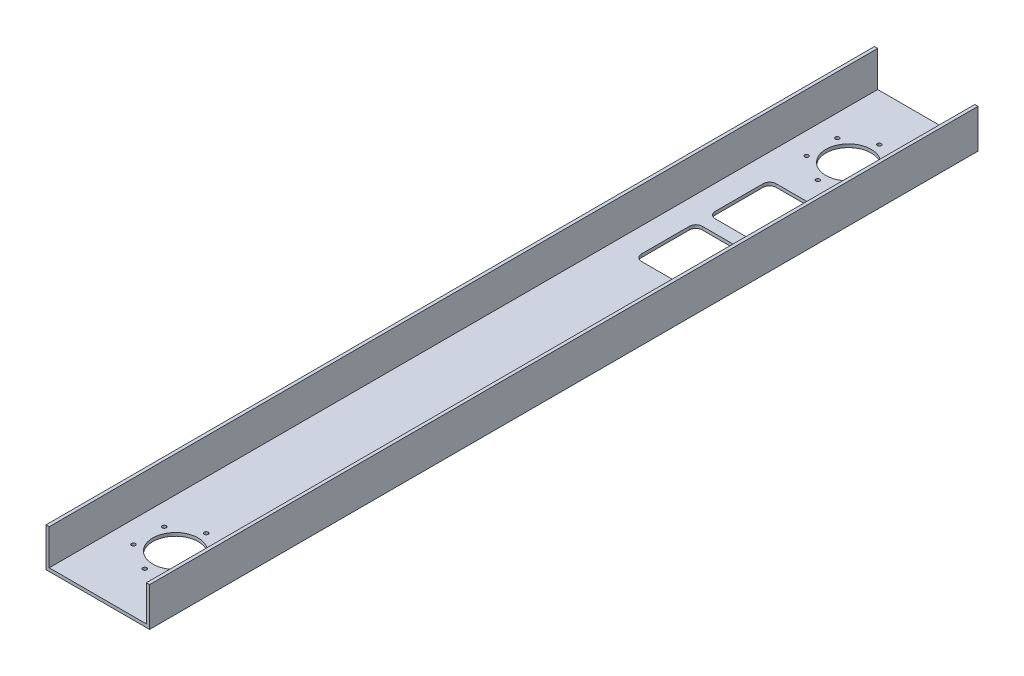
from build123d import *

# Parameters (mm, degrees)
BOSS_EXTRUDE1_DEPTH = 812.8
CUT_EXTRUDE1_REACH  = 822.011
SKETCH2_R           = 22.2377
CUT_EXTRUDE2_REACH  = 822.011
SKETCH3_R           = 1.89865
CUT_EXTRUDE3_REACH  = 822.011


with BuildPart() as part:
    # Sketch1 → Boss-Extrude1 (new body)
    with BuildSketch(Plane.XY):
        Polygon((3.175, 3.175), (3.175, 38.1), (0, 38.1), (0, 0), (101.6, 0), (101.6, 38.1), (98.425, 38.1), (98.425, 3.175), align=None)
    extrude(amount=BOSS_EXTRUDE1_DEPTH)

    # Sketch2 → Cut-Extrude1 (cut, up to next)
    with BuildSketch(Plane.XZ, mode=Mode.PRIVATE) as cut_extrude1_sk1:
        with Locations((50.8, 736.6)):
            Circle(SKETCH2_R)
    cut_extrude1_tool1 = extrude(cut_extrude1_sk1.sketch, amount=-CUT_EXTRUDE1_REACH, mode=Mode.PRIVATE) & part.part
    cut_extrude1 = cut_extrude1_tool1.solids().sort_by_distance((50.8, 0, 736.6))[0]
    add(cut_extrude1, mode=Mode.SUBTRACT)

    # Sketch3 → Cut-Extrude2 (cut, up to next)
    with BuildSketch(Plane.XZ, mode=Mode.PRIVATE) as cut_extrude2_sk1:
        with Locations((50.8, 766.7625)):
            Circle(SKETCH3_R)
    cut_extrude2_tool1 = extrude(cut_extrude2_sk1.sketch, amount=-CUT_EXTRUDE2_REACH, mode=Mode.PRIVATE) & part.part
    # Sketch3 → Cut-Extrude2 (cut, up to next)
    with BuildSketch(Plane.XZ, mode=Mode.PRIVATE) as cut_extrude2_sk2:
        with Locations((76.921491242, 751.68125)):
            Circle(SKETCH3_R)
    cut_extrude2_tool2 = extrude(cut_extrude2_sk2.sketch, amount=-CUT_EXTRUDE2_REACH, mode=Mode.PRIVATE) & part.part
    # Sketch3 → Cut-Extrude2 (cut, up to next)
    with BuildSketch(Plane.XZ, mode=Mode.PRIVATE) as cut_extrude2_sk3:
        with Locations((76.921491242, 721.51875)):
            Circle(SKETCH3_R)
    cut_extrude2_tool3 = extrude(cut_extrude2_sk3.sketch, amount=-CUT_EXTRUDE2_REACH, mode=Mode.PRIVATE) & part.part
    # Sketch3 → Cut-Extrude2 (cut, up to next)
    with BuildSketch(Plane.XZ, mode=Mode.PRIVATE) as cut_extrude2_sk4:
        with Locations((50.8, 706.4375)):
            Circle(SKETCH3_R)
    cut_extrude2_tool4 = extrude(cut_extrude2_sk4.sketch, amount=-CUT_EXTRUDE2_REACH, mode=Mode.PRIVATE) & part.part
    # Sketch3 → Cut-Extrude2 (cut, up to next)
    with BuildSketch(Plane.XZ, mode=Mode.PRIVATE) as cut_extrude2_sk5:
        with Locations((24.678508758, 721.51875)):
            Circle(SKETCH3_R)
    cut_extrude2_tool5 = extrude(cut_extrude2_sk5.sketch, amount=-CUT_EXTRUDE2_REACH, mode=Mode.PRIVATE) & part.part
    # Sketch3 → Cut-Extrude2 (cut, up to next)
    with BuildSketch(Plane.XZ, mode=Mode.PRIVATE) as cut_extrude2_sk6:
        with Locations((24.678508758, 751.68125)):
            Circle(SKETCH3_R)
    cut_extrude2_tool6 = extrude(cut_extrude2_sk6.sketch, amount=-CUT_EXTRUDE2_REACH, mode=Mode.PRIVATE) & part.part
    cut_extrude2_1 = cut_extrude2_tool1.solids().sort_by_distance((50.8, 0, 766.7625))[0]
    add(cut_extrude2_1, mode=Mode.SUBTRACT)
    cut_extrude2_2 = cut_extrude2_tool2.solids().sort_by_distance((76.921491, 0, 751.68125))[0]
    add(cut_extrude2_2, mode=Mode.SUBTRACT)
    cut_extrude2_3 = cut_extrude2_tool3.solids().sort_by_distance((76.921491, 0, 721.51875))[0]
    add(cut_extrude2_3, mode=Mode.SUBTRACT)
    cut_extrude2_4 = cut_extrude2_tool4.solids().sort_by_distance((50.8, 0, 706.4375))[0]
    add(cut_extrude2_4, mode=Mode.SUBTRACT)
    cut_extrude2_5 = cut_extrude2_tool5.solids().sort_by_distance((24.678509, 0, 721.51875))[0]
    add(cut_extrude2_5, mode=Mode.SUBTRACT)
    cut_extrude2_6 = cut_extrude2_tool6.solids().sort_by_distance((24.678509, 0, 751.68125))[0]
    add(cut_extrude2_6, mode=Mode.SUBTRACT)
    cut_extrude2 = cut_extrude2_1 + cut_extrude2_2 + cut_extrude2_3 + cut_extrude2_4 + cut_extrude2_5 + cut_extrude2_6  # Cut-Extrude2 as one shape, for the pattern or mirror that repeats it

    # Mirror1: Cut-Extrude1, Cut-Extrude2 across plane
    add(cut_extrude1.mirror(Plane.XY.offset(406.4)), mode=Mode.SUBTRACT)
    add(cut_extrude2.mirror(Plane.XY.offset(406.4)), mode=Mode.SUBTRACT)

    # Sketch4 → Cut-Extrude3 (cut, up to next)
    with BuildSketch(Plane.XZ, mode=Mode.PRIVATE) as cut_extrude3_sk1:
        with BuildLine():
            Line((68.2625, 129.836281806), (33.3375, 129.836281806))
            ThreePointArc((33.3375, 129.836281806), (28.847371939, 131.696153745), (26.9875, 136.186281806))
            Line((26.9875, 136.186281806), (26.9875, 183.200007549))
            ThreePointArc((26.9875, 183.200007549), (28.847371939, 187.690135609), (33.3375, 189.550007549))
            Line((33.3375, 189.550007549), (68.2625, 189.550007549))
            ThreePointArc((68.2625, 189.550007549), (72.752628061, 187.690135609), (74.6125, 183.200007549))
            Line((74.6125, 183.200007549), (74.6125, 136.186281806))
            ThreePointArc((74.6125, 136.186281806), (72.752628061, 131.696153745), (68.2625, 129.836281806))
        make_face()
    cut_extrude3_tool1 = extrude(cut_extrude3_sk1.sketch, amount=-CUT_EXTRUDE3_REACH, mode=Mode.PRIVATE) & part.part
    # Sketch4 → Cut-Extrude3 (cut, up to next)
    with BuildSketch(Plane.XZ, mode=Mode.PRIVATE) as cut_extrude3_sk2:
        with BuildLine():
            Line((68.2625, 261.963733292), (33.3375, 261.963733292))
            ThreePointArc((33.3375, 261.963733292), (28.847371939, 260.103861353), (26.9875, 255.613733292))
            Line((26.9875, 255.613733292), (26.9875, 208.600007549))
            ThreePointArc((26.9875, 208.600007549), (28.847371939, 204.109879488), (33.3375, 202.250007549))
            Line((33.3375, 202.250007549), (68.2625, 202.250007549))
            ThreePointArc((68.2625, 202.250007549), (72.752628061, 204.109879488), (74.6125, 208.600007549))
            Line((74.6125, 208.600007549), (74.6125, 255.613733292))
            ThreePointArc((74.6125, 255.613733292), (72.752628061, 260.103861353), (68.2625, 261.963733292))
        make_face()
    cut_extrude3_tool2 = extrude(cut_extrude3_sk2.sketch, amount=-CUT_EXTRUDE3_REACH, mode=Mode.PRIVATE) & part.part
    add(cut_extrude3_tool1.solids().sort_by_distance((50.8, 0, 159.693145))[0], mode=Mode.SUBTRACT)
    add(cut_extrude3_tool2.solids().sort_by_distance((50.8, 0, 232.10687))[0], mode=Mode.SUBTRACT)


solid = part.part
